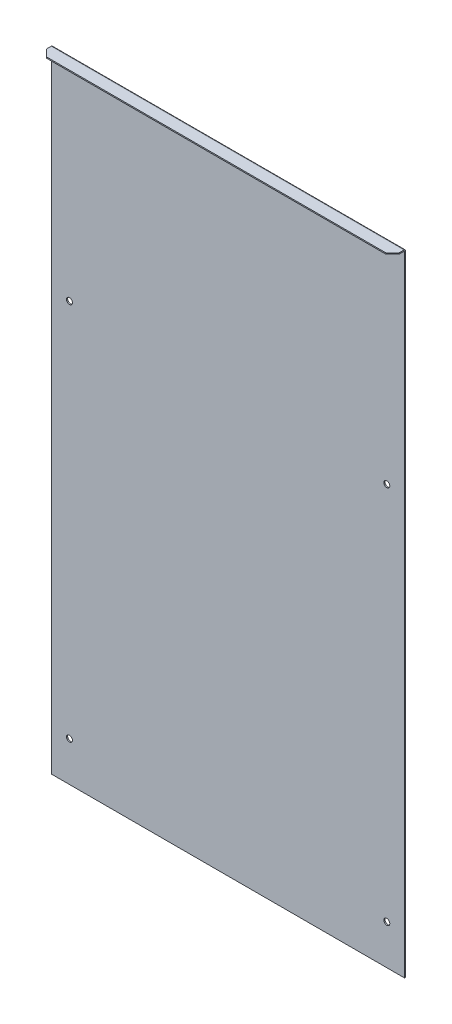
from build123d import *

# Parameters (mm, degrees)
SKETCH1_W           = 266.4508474
SKETCH1_H           = 475
BASE_FLANGE1_DEPTH  = 0.889
SKETCH6_R           = 2.25
CUT_EXTRUDE1_DEPTH  = 0.889
EDGE_FLANGE3_DEPTH  = 266.4508474
BREAK_CORNER1_START = 0.381
BREAK_CORNER1_DEPTH = 0.889


# Read off the part's stored shape, not the designer's step: Break-Corner1
# Sheet-metal steps are written as plain solids
with BuildPart() as part:
    # Sketch1 → Base-Flange1 (new body)
    with BuildSketch(Plane.XY):
        with Locations((0, -237.5)):
            Rectangle(SKETCH1_W, SKETCH1_H)
    extrude(amount=-BASE_FLANGE1_DEPTH)

    # Sketch6 → Cut-Extrude1 (cut)
    with BuildSketch(Plane(origin=(0, 0, -0.889), x_dir=(-1, 0, 0), z_dir=(0, 0, -1))):
        with Locations((-119.8215307, -158.867160024)):
            Circle(SKETCH6_R)
        with Locations((119.8215307, -158.867160024)):
            Circle(SKETCH6_R)
        with Locations((-119.8215307, -445)):
            Circle(SKETCH6_R)
        with Locations((119.8215307, -445)):
            Circle(SKETCH6_R)
    extrude(amount=-CUT_EXTRUDE1_DEPTH, mode=Mode.SUBTRACT)

    # Edge-Flange3 section (across the edge) → Edge-Flange3 (add)
    with BuildSketch(Plane(origin=(133.2254237, 0.381, 0), x_dir=(0, -1, 0), z_dir=(-1, 0, 0))):
        with BuildLine():
            Line((-0.889, 0.381), (-0.889, 9.111))
            Line((-0.889, 9.111), (0, 9.111))
            Line((0, 9.111), (0, 0.381))
            ThreePointArc((0, 0.381), (0.111592316, 0.111592316), (0.381, 0))
            Line((0.381, 0), (0.381, -0.889))
            ThreePointArc((0.381, -0.889), (-0.517025612, -0.517025612), (-0.889, 0.381))
        make_face()
    extrude(amount=EDGE_FLANGE3_DEPTH)

    # Break-Corner1 outline → Break-Corner1 (cut)
    with BuildSketch(Plane(origin=(0, 0, 0), x_dir=(1, 0, 0), z_dir=(0, 1, 0)).offset(BREAK_CORNER1_START)):
        Polygon((-133.2254237, -9.111), (-128.2254237, -9.111), (-133.2254237, -4.111), align=None)
        Polygon((133.2254237, -4.111), (128.2254237, -9.111), (133.2254237, -9.111), align=None)
    extrude(amount=BREAK_CORNER1_DEPTH, mode=Mode.SUBTRACT)


solid = part.part
